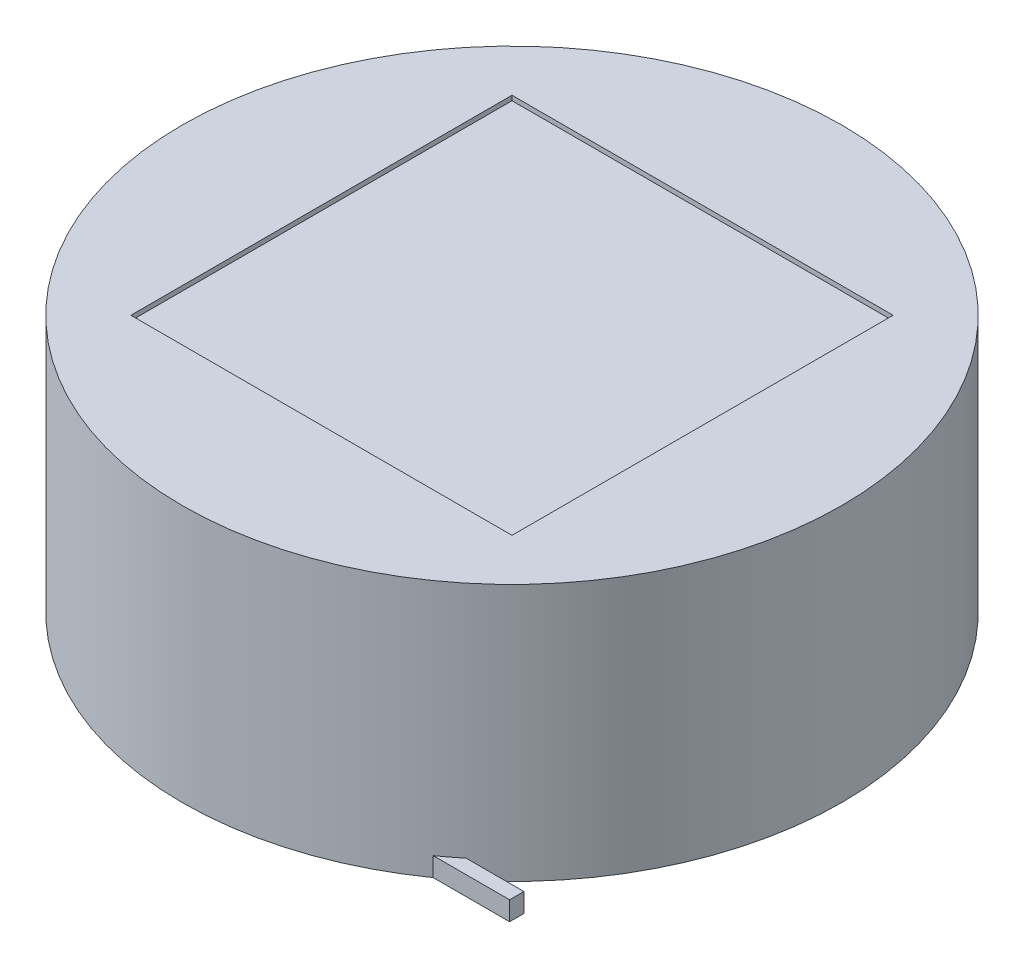
from build123d import *

# Parameters (mm, degrees)
BOSS_EXTRUDE1_DEPTH     = 27
SKETCH4_W               = 40
SKETCH4_H               = 40
CUT_EXTRUDE3_DEPTH      = 0.5
SKETCH1_6_W             = 28
SKETCH1_6_H             = 1.5
EXTRUDE_THIN1_DEPTH     = 2
CUT_EXTRUDE6_DEPTH      = 28
CUT_EXTRUDE6_DEPTH_BACK = 30


with BuildPart() as part:
    # Sketch1 → Boss-Extrude1 (new body)
    with BuildSketch(Plane(origin=(0, 0, 0), x_dir=(1, 0, 0), z_dir=(0, 1, 0))):
        with BuildLine():
            ThreePointArc((-20.997857034, 27.5), (-27.5, -20.997857034), (20.997857034, -27.5))
            ThreePointArc((20.997857034, -27.5), (27.5, 20.997857034), (-20.997857034, 27.5))
        make_face()
    extrude(amount=BOSS_EXTRUDE1_DEPTH)

    # Sketch4 → Cut-Extrude3 (cut)
    with BuildSketch(Plane(origin=(0, 27, 0), x_dir=(1, 0, 0), z_dir=(0, 1, 0))):
        Rectangle(SKETCH4_W, SKETCH4_H)
    extrude(amount=-CUT_EXTRUDE3_DEPTH, mode=Mode.SUBTRACT)

    # Sketch1<6> → Extrude-Thin1 (add)
    with BuildSketch(Plane(origin=(0, 0, 0), x_dir=(1, 0, 0), z_dir=(0, 1, 0))):
        with Locations((-14, 27.5)):
            Rectangle(SKETCH1_6_W, SKETCH1_6_H)
        with Locations((14, -27.5)):
            Rectangle(SKETCH1_6_W, SKETCH1_6_H)
    extrude(amount=EXTRUDE_THIN1_DEPTH)

    # Sketch11 → Cut-Extrude6 (cut, two sides: drawn at the far end of the back side and taken through both)
    with BuildSketch(Plane(origin=(0, 0, 0), x_dir=(0, 0, -1), z_dir=(1, 0, 0)).offset(-CUT_EXTRUDE6_DEPTH_BACK)):
        Polygon((34.6, 0), (34.6, 4.984885974), (29.615114026, 0), align=None)
    extrude(amount=CUT_EXTRUDE6_DEPTH + CUT_EXTRUDE6_DEPTH_BACK, mode=Mode.SUBTRACT)


solid = part.part
